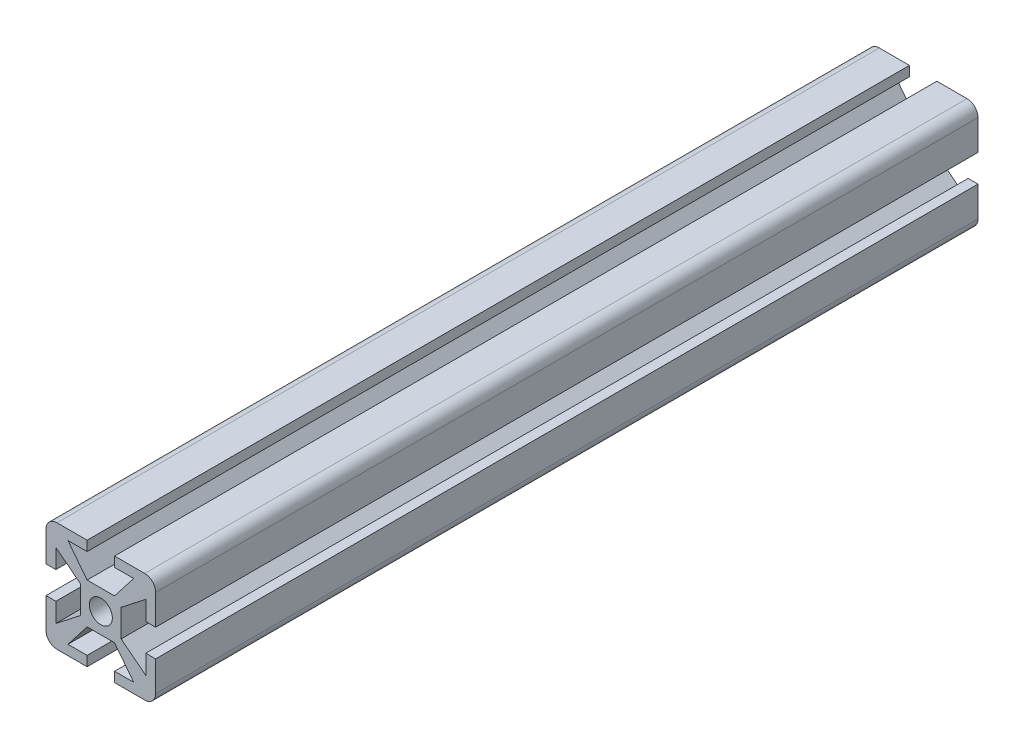
from build123d import *

# Parameters (mm, degrees)
EXTRUSION1_DEPTH        = 150
PER_AGE1_OUTLINE_R      = 2.1
PER_AGE1_DEPTH          = 150
ENL_V_MAT_EXTRU_1_DEPTH = 300
ENL_V_MAT_EXTRU_3_DEPTH = 300
ENL_V_MAT_EXTRU_4_DEPTH = 151.665191733
ENL_V_MAT_EXTRU_7_DEPTH = 151.665191733


# Read off the part's stored shape, not the designer's step: Perçage1
with BuildPart() as part:
    # Esquisse1 → Extrusion1 (new body)
    with BuildSketch(Plane.XY):
        with BuildLine():
            Line((-10, 8), (-10, -8))
            ThreePointArc((-10, -8), (-9.414213562, -9.414213562), (-8, -10))
            Line((-8, -10), (8, -10))
            ThreePointArc((8, -10), (9.414213562, -9.414213562), (10, -8))
            Line((10, -8), (10, 8))
            ThreePointArc((10, 8), (9.414213562, 9.414213562), (8, 10))
            Line((8, 10), (-8, 10))
            ThreePointArc((-8, 10), (-9.414213562, 9.414213562), (-10, 8))
        make_face()
    extrude(amount=EXTRUSION1_DEPTH)

    # Perçage1 outline → Perçage1 (cut)
    with BuildSketch(Plane.XY):
        Circle(PER_AGE1_OUTLINE_R)
    extrude(amount=PER_AGE1_DEPTH, mode=Mode.SUBTRACT)

    # Esquisse3 → Enlèv. mat.-Extru.1 (cut)
    with BuildSketch(Plane.XY.offset(150)):
        Polygon((10, 2.5), (8.2, 2.5), (8.2, 6), (3.7, 2.5), (3.7, -2.5), (8.2, -6), (8.2, -2.5), (10, -2.5), align=None)
    extrude(amount=-ENL_V_MAT_EXTRU_1_DEPTH, mode=Mode.SUBTRACT)

    # Esquisse5 → Enlèv. mat.-Extru.3 (cut)
    with BuildSketch(Plane.XY.offset(150)):
        Polygon((-2.5, 10), (-2.5, 8.2), (-6, 8.2), (-2.5, 3.7), (2.5, 3.7), (6, 8.2), (2.5, 8.2), (2.5, 10), align=None)
    extrude(amount=-ENL_V_MAT_EXTRU_3_DEPTH, mode=Mode.SUBTRACT)

    # Esquisse6 → Enlèv. mat.-Extru.4 (cut, through all)
    with BuildSketch(Plane.XY.offset(150)):
        Polygon((-2.5, -10), (-2.5, -8.2), (-6, -8.2), (-2.5, -3.7), (2.5, -3.7), (6, -8.2), (2.5, -8.2), (2.5, -10), align=None)
    extrude(amount=-ENL_V_MAT_EXTRU_4_DEPTH, mode=Mode.SUBTRACT)

    # Esquisse4 → Enlèv. mat.-Extru.7 (cut, through all)
    with BuildSketch(Plane.XY.offset(150)):
        Polygon((-10, 2.5), (-8.2, 2.5), (-8.2, 6), (-3.7, 2.5), (-3.7, -2.5), (-8.2, -6), (-8.2, -2.5), (-10, -2.5), align=None)
    extrude(amount=-ENL_V_MAT_EXTRU_7_DEPTH, mode=Mode.SUBTRACT)


solid = part.part
